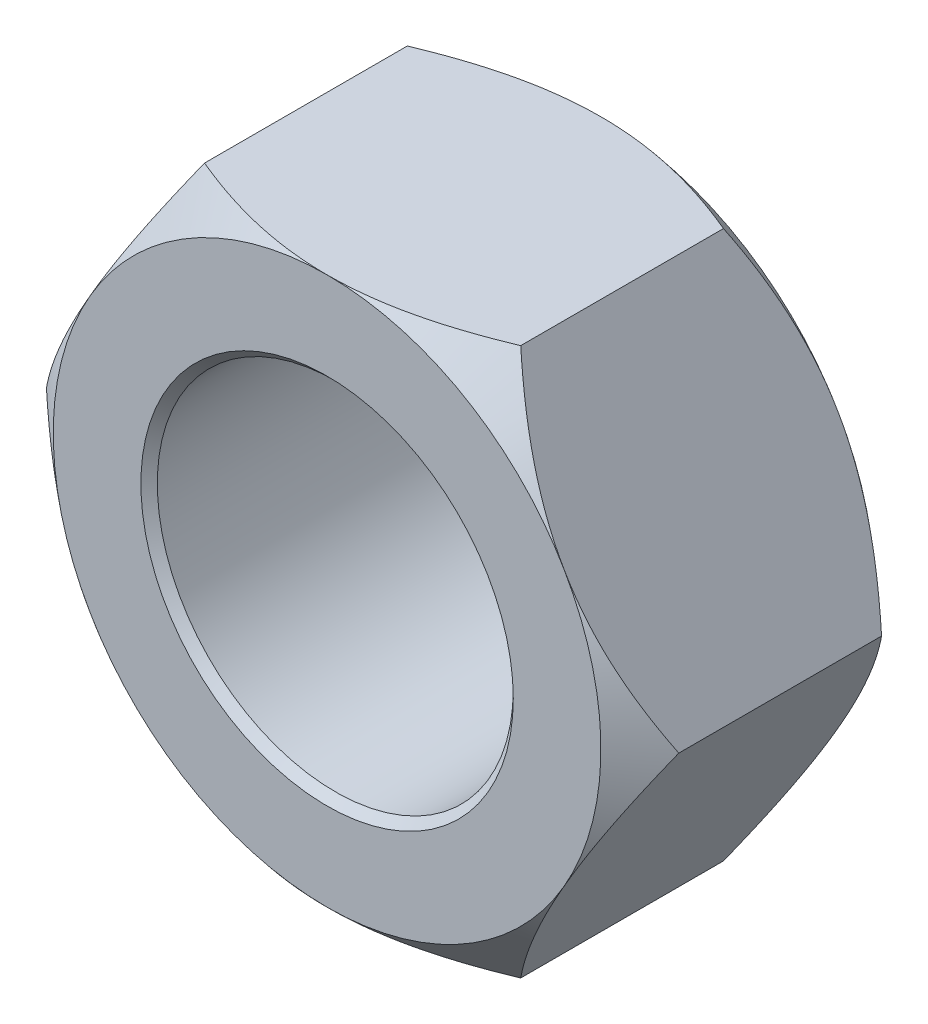
from build123d import *

# Parameters (mm, degrees)
SKETCH1_R               = 6.5
BOSS_EXTRUDE1_DEPTH     = 10
SKETCH2_OUTSIDE_W       = 38.674
SKETCH2_OUTSIDE_H       = 35.58
SKETCH2_OUTSIDE_R       = 10
CUT_EXTRUDE1_DEPTH      = 3
CUT_EXTRUDE1_DRAFT      = -50
MIRROR1_COPY_1_SKETCH_W = 38.674
MIRROR1_COPY_1_SKETCH_H = 35.58
MIRROR1_COPY_1_SKETCH_R = 10
MIRROR1_COPY_1_DEPTH    = 3
MIRROR1_COPY_1_DRAFT    = -50
CHAMFER1_SIZE           = 0.3


with BuildPart() as part:
    # Sketch1 → Boss-Extrude1 (new body)
    with BuildSketch(Plane.XY):
        Polygon((-11.547005384, 0), (-5.773502692, -10), (5.773502692, -10), (11.547005384, 0), (5.773502692, 10), (-5.773502692, 10), align=None)
        Circle(SKETCH1_R, mode=Mode.SUBTRACT)
    extrude(amount=BOSS_EXTRUDE1_DEPTH)


with BuildPart() as cut_extrude1_tool:
    # Sketch2 outside → Cut-Extrude1 (with draft: the straight prism first)
    with BuildSketch(Plane.XY.offset(10)):
        Rectangle(SKETCH2_OUTSIDE_W, SKETCH2_OUTSIDE_H)
        Circle(SKETCH2_OUTSIDE_R, mode=Mode.SUBTRACT)
    extrude(amount=-CUT_EXTRUDE1_DEPTH)
    # Cut-Extrude1: the draft: its side faces are tilted about the plane it starts from
    cut_extrude1_sides = [cut_extrude1_tool.faces().sort_by_distance(p)[0] for p in [
        (0, -17.79, 8.5),
        (19.337, 0, 8.5),
        (0, 17.79, 8.5),
        (-19.337, 0, 8.5),
        (-10, 0, 8.5),
    ]]
    draft(cut_extrude1_sides, Plane.XY.offset(10), CUT_EXTRUDE1_DRAFT)


with BuildPart() as part_1:
    add(part.part)

    # Cut-Extrude1: cut by cut_extrude1_tool
    add(cut_extrude1_tool.part, mode=Mode.SUBTRACT)


with BuildPart() as mirror1_copy_1_tool:
    # Mirror1 copy 1 sketch → Mirror1 copy 1 (with draft: the straight prism first)
    with BuildSketch(Plane(origin=(0, 0, 0), x_dir=(1, 0, 0), z_dir=(0, 0, -1))):
        Rectangle(MIRROR1_COPY_1_SKETCH_W, MIRROR1_COPY_1_SKETCH_H)
        Circle(MIRROR1_COPY_1_SKETCH_R, mode=Mode.SUBTRACT)
    extrude(amount=-MIRROR1_COPY_1_DEPTH)
    # Mirror1 copy 1: the draft: its side faces are tilted about the plane it starts from
    mirror1_copy_1_sides = [mirror1_copy_1_tool.faces().sort_by_distance(p)[0] for p in [
        (0, -17.79, 1.5),
        (19.337, 0, 1.5),
        (0, 17.79, 1.5),
        (-19.337, 0, 1.5),
        (-10, 0, 1.5),
    ]]
    draft(mirror1_copy_1_sides, Plane(origin=(0, 0, 0), x_dir=(1, 0, 0), z_dir=(0, 0, -1)), MIRROR1_COPY_1_DRAFT)


with BuildPart() as part_2:
    add(part_1.part)

    # Mirror1 copy 1: cut by mirror1_copy_1_tool
    add(mirror1_copy_1_tool.part, mode=Mode.SUBTRACT)

    # Chamfer1
    chamfer1_edges = [part_2.edges().sort_by_distance(p)[0] for p in [
        (-6.5, 0, 0),
        (-6.5, 0, 10),
    ]]
    chamfer(chamfer1_edges, length=CHAMFER1_SIZE)


solid = part_2.part
